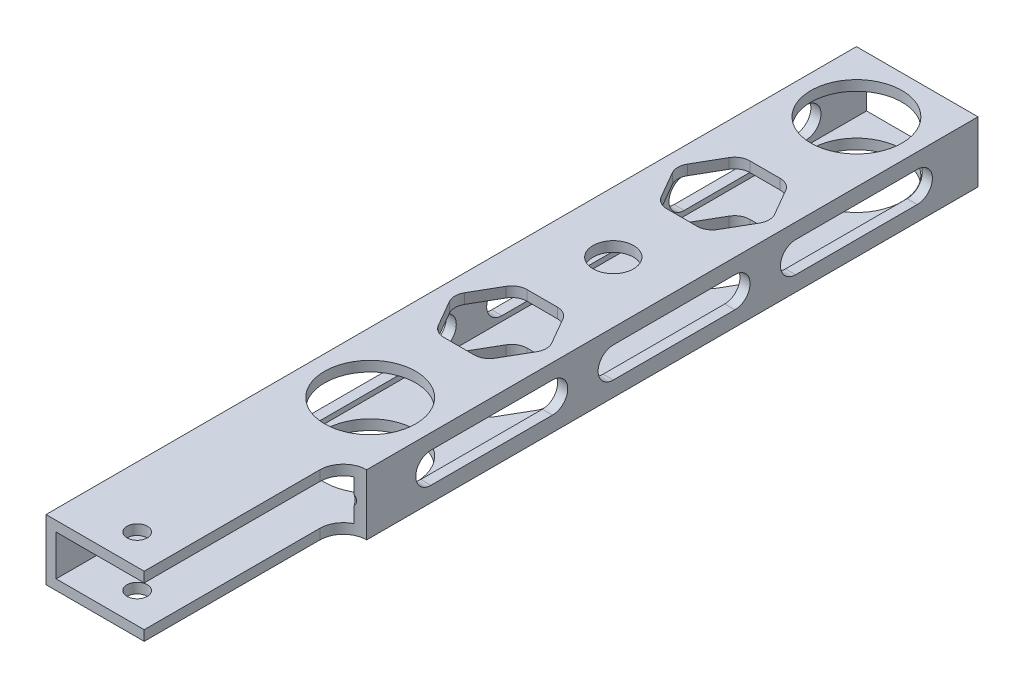
from build123d import *

# Parameters (mm, degrees)
SKETCH1_W           = 38.1
SKETCH1_H           = 19.05
SKETCH1_W_2         = 31.75
SKETCH1_H_2         = 12.7
BOSS_EXTRUDE1_DEPTH = 254
SKETCH2_R           = 14.2875
CUT_EXTRUDE1_DEPTH  = 258.547107342
SKETCH3_R           = 3.175
CUT_EXTRUDE2_DEPTH  = 258.547107342
CUT_EXTRUDE3_DEPTH  = 258.547107342
SKETCH5_R           = 2.667
CUT_EXTRUDE4_DEPTH  = 258.547107342
CUT_EXTRUDE6_DEPTH  = 258.547107342
CUT_EXTRUDE7_DEPTH  = 258.547107364
CUT_EXTRUDE8_REACH  = 259.547
SKETCH6_R           = 6.35


with BuildPart() as part:
    # Sketch1 → Boss-Extrude1 (new body)
    with BuildSketch(Plane.XY):
        with Locations((19.05, 9.525)):
            Rectangle(SKETCH1_W, SKETCH1_H)
        with Locations((19.05, 9.525)):
            Rectangle(SKETCH1_W_2, SKETCH1_H_2, mode=Mode.SUBTRACT)
    extrude(amount=BOSS_EXTRUDE1_DEPTH)

    # Sketch2 → Cut-Extrude1 (cut, through all)
    with BuildSketch(Plane(origin=(0, 19.05, 0), x_dir=(1, 0, 0), z_dir=(0, 1, 0))):
        with Locations((19.05, -19.05)):
            Circle(SKETCH2_R)
        with Locations((19.05, -171.45)):
            Circle(SKETCH2_R)
    extrude(amount=-CUT_EXTRUDE1_DEPTH, mode=Mode.SUBTRACT)

    # Sketch3 → Cut-Extrude2 (cut, through all)
    with BuildSketch(Plane(origin=(0, 19.05, 0), x_dir=(1, 0, 0), z_dir=(0, 1, 0))):
        with Locations((19.05, -244.475)):
            Circle(SKETCH3_R)
    extrude(amount=-CUT_EXTRUDE2_DEPTH, mode=Mode.SUBTRACT)

    # Sketch4 → Cut-Extrude3 (cut, through all)
    with BuildSketch(Plane(origin=(0, 19.05, 0), x_dir=(1, 0, 0), z_dir=(0, 1, 0))):
        with BuildLine():
            Line((30.774464213, -254), (30.774464213, -198.91983478))
            ThreePointArc((30.774464213, -198.91983478), (32.920063969, -193.739898749), (38.1, -191.594298992))
            Line((38.1, -191.594298992), (38.1, -254))
            Line((38.1, -254), (30.774464213, -254))
        make_face()
    extrude(amount=-CUT_EXTRUDE3_DEPTH, mode=Mode.SUBTRACT)

    # Sketch5 → Cut-Extrude4 (cut, through all)
    with BuildSketch(Plane.XZ):
        with Locations((19.05, 95.25)):
            Circle(SKETCH5_R)
    extrude(amount=-CUT_EXTRUDE4_DEPTH, mode=Mode.SUBTRACT)

    # Sketch7 → Cut-Extrude6 (cut, through all)
    with BuildSketch(Plane.ZY):
        with BuildLine():
            Line((19.05, 14.2875), (57.15, 14.2875))
            ThreePointArc((57.15, 14.2875), (61.9125, 9.525), (57.15, 4.7625))
            Line((57.15, 4.7625), (19.05, 4.7625))
            ThreePointArc((19.05, 4.7625), (14.2875, 9.525), (19.05, 14.2875))
        make_face()
        with BuildLine():
            Line((76.2, 14.2875), (114.3, 14.2875))
            ThreePointArc((114.3, 14.2875), (119.0625, 9.525), (114.3, 4.7625))
            Line((114.3, 4.7625), (76.2, 4.7625))
            ThreePointArc((76.2, 4.7625), (71.4375, 9.525), (76.2, 14.2875))
        make_face()
        with BuildLine():
            Line((133.35, 14.2875), (171.45, 14.2875))
            ThreePointArc((171.45, 14.2875), (176.2125, 9.525), (171.45, 4.7625))
            Line((171.45, 4.7625), (133.35, 4.7625))
            ThreePointArc((133.35, 4.7625), (128.5875, 9.525), (133.35, 14.2875))
        make_face()
        with BuildLine():
            Line((196.85, 14.2875), (234.95, 14.2875))
            ThreePointArc((234.95, 14.2875), (239.7125, 9.525), (234.95, 4.7625))
            Line((234.95, 4.7625), (196.85, 4.7625))
            ThreePointArc((196.85, 4.7625), (192.0875, 9.525), (196.85, 14.2875))
        make_face()
    extrude(amount=-CUT_EXTRUDE6_DEPTH, mode=Mode.SUBTRACT)

    # Sketch8 → Cut-Extrude7 (cut, through all)
    with BuildSketch(Plane(origin=(0, 19.05, 0), x_dir=(1, 0, 0), z_dir=(0, 1, 0))):
        with BuildLine():
            Line((5.400554014, -63.102041579), (10.163054014, -71.35093355))
            ThreePointArc((10.163054014, -71.35093355), (11.90625, -73.094129535), (14.2875, -73.73218355))
            Line((14.2875, -73.73218355), (23.8125, -73.73218355))
            ThreePointArc((23.8125, -73.73218355), (26.19375, -73.094129535), (27.936945986, -71.35093355))
            Line((27.936945986, -71.35093355), (32.699445986, -63.102041579))
            ThreePointArc((32.699445986, -63.102041579), (33.3375, -60.720791579), (32.699445986, -58.339541579))
            Line((32.699445986, -58.339541579), (27.936945986, -50.090649608))
            ThreePointArc((27.936945986, -50.090649608), (26.19375, -48.347453622), (23.8125, -47.709399608))
            Line((23.8125, -47.709399608), (14.2875, -47.709399608))
            ThreePointArc((14.2875, -47.709399608), (11.90625, -48.347453622), (10.163054014, -50.090649608))
            Line((10.163054014, -50.090649608), (5.400554014, -58.339541579))
            ThreePointArc((5.400554014, -58.339541579), (4.7625, -60.720791579), (5.400554014, -63.102041579))
        make_face()
        with BuildLine():
            Line((5.400554014, -132.952041579), (10.163054014, -141.20093355))
            ThreePointArc((10.163054014, -141.20093355), (11.90625, -142.944129535), (14.2875, -143.58218355))
            Line((14.2875, -143.58218355), (23.8125, -143.58218355))
            ThreePointArc((23.8125, -143.58218355), (26.19375, -142.944129535), (27.936945986, -141.20093355))
            Line((27.936945986, -141.20093355), (32.699445986, -132.952041579))
            ThreePointArc((32.699445986, -132.952041579), (33.3375, -130.570791579), (32.699445986, -128.189541579))
            Line((32.699445986, -128.189541579), (27.936945986, -119.940649608))
            ThreePointArc((27.936945986, -119.940649608), (26.19375, -118.197453622), (23.8125, -117.559399608))
            Line((23.8125, -117.559399608), (14.2875, -117.559399608))
            ThreePointArc((14.2875, -117.559399608), (11.90625, -118.197453622), (10.163054014, -119.940649608))
            Line((10.163054014, -119.940649608), (5.400554014, -128.189541579))
            ThreePointArc((5.400554014, -128.189541579), (4.7625, -130.570791579), (5.400554014, -132.952041579))
        make_face()
    extrude(amount=-CUT_EXTRUDE7_DEPTH, mode=Mode.SUBTRACT)

    # Sketch6 → Cut-Extrude8 (cut, up to next)
    with BuildSketch(Plane(origin=(0, 19.05, 0), x_dir=(1, 0, 0), z_dir=(0, 1, 0)), mode=Mode.PRIVATE) as cut_extrude8_sk1:
        with Locations((19.05, -95.25)):
            Circle(SKETCH6_R)
    cut_extrude8_tool1 = extrude(cut_extrude8_sk1.sketch, amount=-CUT_EXTRUDE8_REACH, mode=Mode.PRIVATE) & part.part
    add(cut_extrude8_tool1.solids().sort_by_distance((19.05, 19.05, 95.25))[0], mode=Mode.SUBTRACT)


solid = part.part
